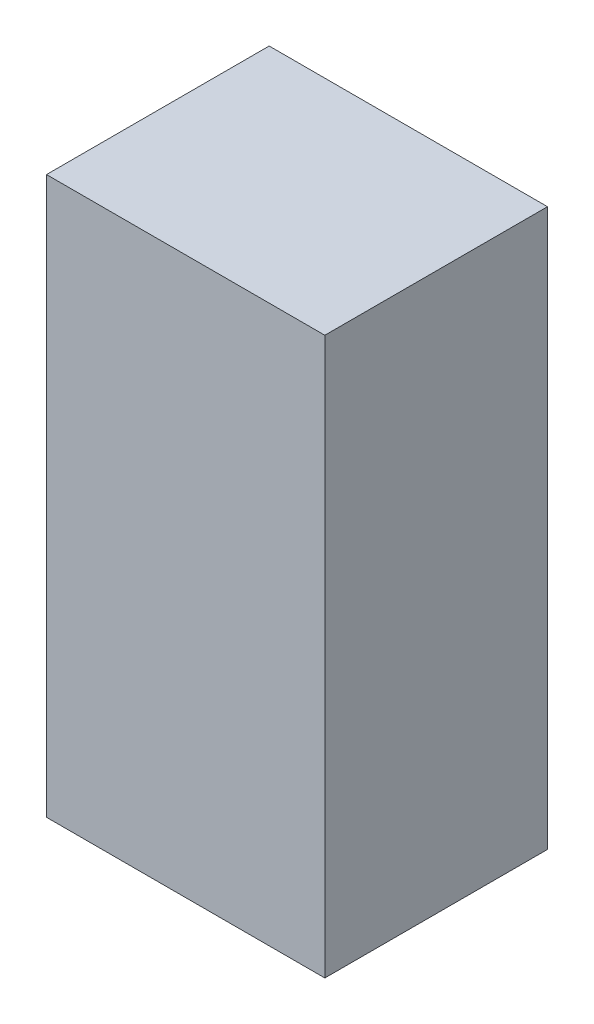
from build123d import *

# Parameters (mm, degrees)
SKETCH1_W           = 50
SKETCH1_H           = 40
BOSS_EXTRUDE1_DEPTH = 100


with BuildPart() as part:
    # Sketch1 → Boss-Extrude1 (new body)
    with BuildSketch(Plane(origin=(0, 0, 0), x_dir=(1, 0, 0), z_dir=(0, 1, 0))):
        Rectangle(SKETCH1_W, SKETCH1_H)
    extrude(amount=BOSS_EXTRUDE1_DEPTH)


solid = part.part
